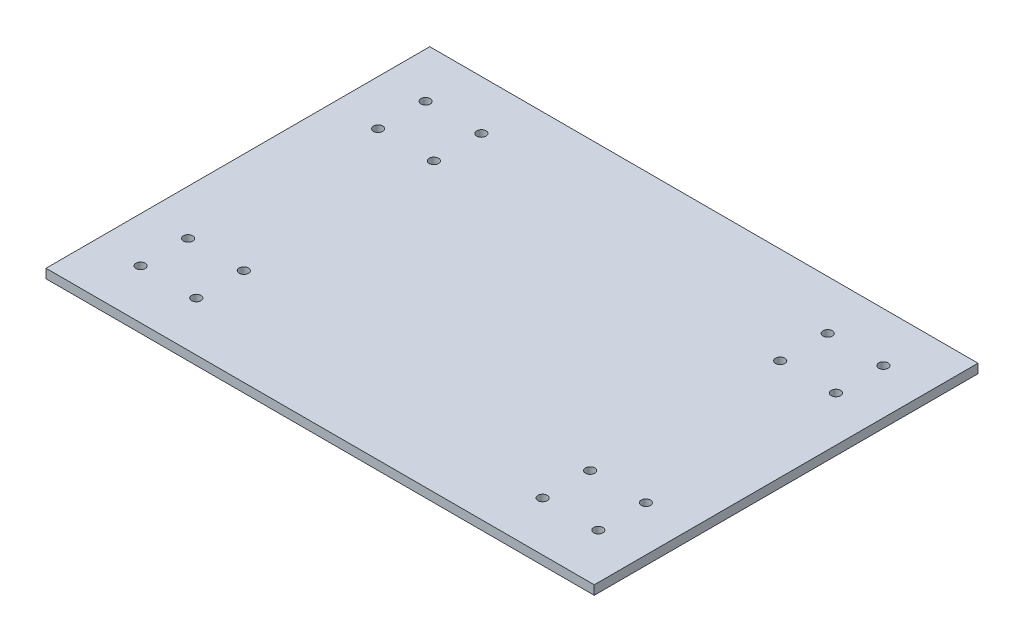
from build123d import *

# Parameters (mm, degrees)
SKETCH1_W           = 300
SKETCH1_H           = 210
BOSS_EXTRUDE1_DEPTH = 2.5
SKETCH2_R           = 2.55
CUT_EXTRUDE1_DEPTH  = 184.16659084


with BuildPart() as part:
    # Sketch1 → Boss-Extrude1 (new, symmetric)
    with BuildSketch(Plane(origin=(0, 0, 0), x_dir=(1, 0, 0), z_dir=(0, 1, 0))):
        Rectangle(SKETCH1_W, SKETCH1_H)
    extrude(amount=BOSS_EXTRUDE1_DEPTH, both=True)

    # Sketch2 → Cut-Extrude1 (cut, through all)
    with BuildSketch(Plane(origin=(0, 2.5, 0), x_dir=(1, 0, 0), z_dir=(0, 1, 0))):
        with Locations((-125.25, 78)):
            Circle(SKETCH2_R)
        with Locations((-125.25, 52)):
            Circle(SKETCH2_R)
        with Locations((-94.75, 78)):
            Circle(SKETCH2_R)
        with Locations((-94.75, 52)):
            Circle(SKETCH2_R)
        with Locations((-125.25, -52)):
            Circle(SKETCH2_R)
        with Locations((-125.25, -78)):
            Circle(SKETCH2_R)
        with Locations((-94.75, -78)):
            Circle(SKETCH2_R)
        with Locations((-94.75, -52)):
            Circle(SKETCH2_R)
        with Locations((125.25, -52)):
            Circle(SKETCH2_R)
        with Locations((94.75, -52)):
            Circle(SKETCH2_R)
        with Locations((94.75, -78)):
            Circle(SKETCH2_R)
        with Locations((125.25, -78)):
            Circle(SKETCH2_R)
        with Locations((94.75, 78)):
            Circle(SKETCH2_R)
        with Locations((94.75, 52)):
            Circle(SKETCH2_R)
        with Locations((125.25, 78)):
            Circle(SKETCH2_R)
        with Locations((125.25, 52)):
            Circle(SKETCH2_R)
    extrude(amount=-CUT_EXTRUDE1_DEPTH, mode=Mode.SUBTRACT)


solid = part.part
